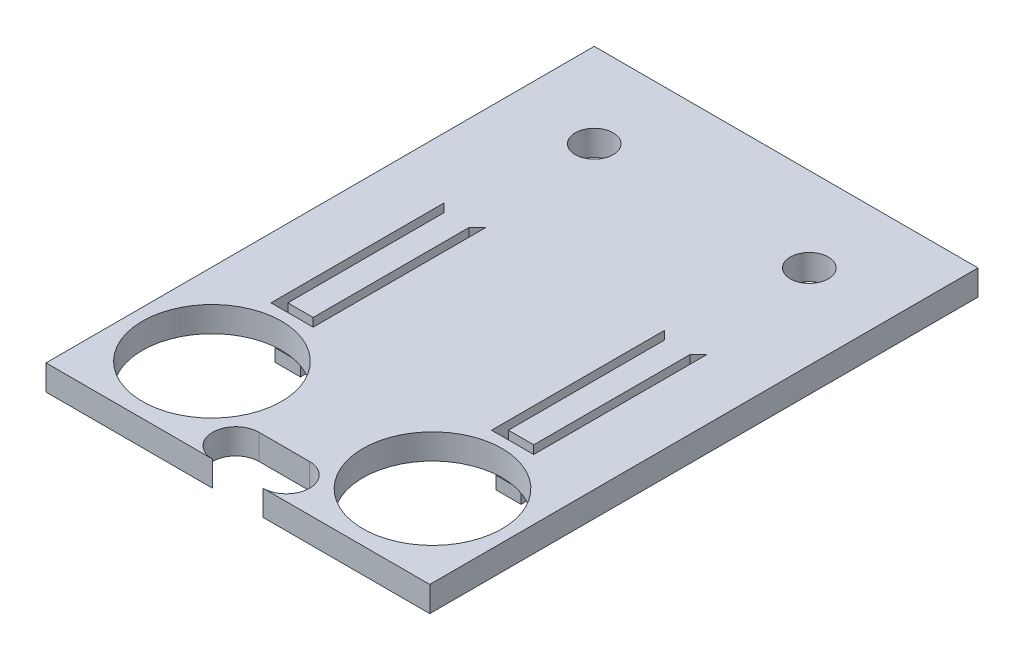
from build123d import *

# Parameters (mm, degrees)
SKETCH1_W           = 45.5
SKETCH1_H           = 3
BOSS_EXTRUDE1_DEPTH = 20
SKETCH2_W           = 45.5
SKETCH2_H           = 3
BOSS_EXTRUDE2_DEPTH = 45
SKETCH3_R           = 8.25
CUT_EXTRUDE1_DEPTH  = 75.656105932
CUT_EXTRUDE2_DEPTH  = 75.656105932
BOSS_EXTRUDE4_DEPTH = 3
CUT_EXTRUDE3_DEPTH  = 75.656105932
SKETCH10_W          = 10
SKETCH10_H          = 2.5
CUT_EXTRUDE4_DEPTH  = 2
SKETCH13_W          = 3
SKETCH13_H          = 14.133974596
CUT_EXTRUDE6_DEPTH  = 1
CHAMFER1_SIZE       = 1
SKETCH15_R          = 2.25
CUT_EXTRUDE7_DEPTH  = 75.788557826
CHAMFER2_SIZE       = 1


with BuildPart() as part:
    # Sketch1 → Boss-Extrude1 (new body)
    with BuildSketch(Plane.XY):
        with Locations((-13.849646897, 14.534741944)):
            Rectangle(SKETCH1_W, SKETCH1_H)
    extrude(amount=BOSS_EXTRUDE1_DEPTH)

    # Sketch2 → Boss-Extrude2 (add)
    with BuildSketch(Plane.XY.offset(20)):
        with Locations((-13.849646897, 14.534741944)):
            Rectangle(SKETCH2_W, SKETCH2_H)
    extrude(amount=BOSS_EXTRUDE2_DEPTH)

    # Sketch3 → Cut-Extrude1 (cut, through all)
    with BuildSketch(Plane(origin=(0, 13.034741944, 0), x_dir=(-1, 0, 0), z_dir=(0, -1, 0))):
        with Locations(Location((26.924646897, -55, 0), (0, 0, 90))):
            Circle(SKETCH3_R)
        with Locations(Location((0.774646897, -55, 0), (0, 0, 90))):
            Circle(SKETCH3_R)
    extrude(amount=-CUT_EXTRUDE1_DEPTH, mode=Mode.SUBTRACT)

    # Sketch5 → Cut-Extrude2 (cut, through all)
    with BuildSketch(Plane(origin=(0, 13.034741944, 0), x_dir=(-1, 0, 0), z_dir=(0, -1, 0))):
        Polygon((29.424646897, -25), (29.424646897, -45.5), (24.424646897, -45.5), (24.424646897, -25), (25.424646897, -25), (25.424646897, -44.5), (28.424646897, -44.5), (28.424646897, -25), align=None)
        Polygon((-0.725353103, -25), (-1.725353103, -25), (-1.725353103, -45.5), (3.274646897, -45.5), (3.274646897, -25), (2.274646897, -25), (2.274646897, -44.5), (-0.725353103, -44.5), align=None)
    extrude(amount=-CUT_EXTRUDE2_DEPTH, mode=Mode.SUBTRACT)

    # Sketch6 → Boss-Extrude4 (add)
    with BuildSketch(Plane(origin=(-25.424646897, 0, 0), x_dir=(0, 0, -1), z_dir=(1, 0, 0))):
        Polygon((-44.5, 13.034741944), (-46, 12.16871654), (-46, 10.66871654), (-41.5, 10.66871654), (-39.133974596, 13.034741944), align=None)
    boss_extrude4 = extrude(amount=-BOSS_EXTRUDE4_DEPTH)

    # Mirror7: Boss-Extrude4 across plane
    add(boss_extrude4.mirror(Plane(origin=(-13.849646897, 13.034741944, 25), x_dir=(0, 0, 1), z_dir=(1, 0, 0))))

    # Sketch9 → Cut-Extrude3 (cut, through all)
    with BuildSketch(Plane(origin=(0, 13.034741944, 0), x_dir=(-1, 0, 0), z_dir=(0, -1, 0))):
        with BuildLine():
            Line((16.849646897, -65), (10.849646897, -65))
            ThreePointArc((10.849646897, -65), (8.099646897, -62.25), (10.849646897, -59.5))
            Line((10.849646897, -59.5), (16.849646897, -59.5))
            ThreePointArc((16.849646897, -59.5), (19.599646897, -62.25), (16.849646897, -65))
        make_face()
    extrude(amount=-CUT_EXTRUDE3_DEPTH, mode=Mode.SUBTRACT)

    # Sketch10 → Cut-Extrude4 (cut)
    with BuildSketch(Plane(origin=(0, 13.034741944, 0), x_dir=(-1, 0, 0), z_dir=(0, -1, 0))):
        with Locations((13.849646897, -46.25)):
            Rectangle(SKETCH10_W, SKETCH10_H)
    extrude(amount=-CUT_EXTRUDE4_DEPTH, mode=Mode.SUBTRACT)

    # Sketch13 → Cut-Extrude6 (cut)
    with BuildSketch(Plane(origin=(0, 13.034741944, 0), x_dir=(-1, 0, 0), z_dir=(0, -1, 0))):
        with Locations((26.924646897, -32.066987298)):
            Rectangle(SKETCH13_W, SKETCH13_H)
        with Locations((0.774646897, -32.066987298)):
            Rectangle(SKETCH13_W, SKETCH13_H)
    extrude(amount=-CUT_EXTRUDE6_DEPTH, mode=Mode.SUBTRACT)

    # Chamfer1
    chamfer1_edges = [part.edges().sort_by_distance(p)[0] for p in [
        (-26.924646897, 14.034741944, 25),
        (-0.774646897, 14.034741944, 25),
    ]]
    chamfer(chamfer1_edges, length=CHAMFER1_SIZE - 0.0001)  # a hair under: the kernel refuses the full size

    # Sketch15 → Cut-Extrude7 (cut, through all)
    with BuildSketch(Plane(origin=(0, 16.034741944, 0), x_dir=(1, 0, 0), z_dir=(0, 1, 0))):
        with Locations(Location((-26.599646897, -10, 0), (0, 0, 270))):
            Circle(SKETCH15_R)
        with Locations(Location((-1.099646897, -10, 0), (0, 0, 270))):
            Circle(SKETCH15_R)
    extrude(amount=-CUT_EXTRUDE7_DEPTH, mode=Mode.SUBTRACT)

    # Chamfer2
    chamfer2_edges = [part.edges().sort_by_distance(p)[0] for p in [
        (-28.424646897, 14.534791944, 25),
        (-25.424646897, 14.534791944, 25),
        (0.725353103, 14.534791944, 25),
        (-2.274646897, 14.534791944, 25),
    ]]
    chamfer(chamfer2_edges, length=CHAMFER2_SIZE - 0.0001)  # a hair under: the kernel refuses the full size


solid = part.part
